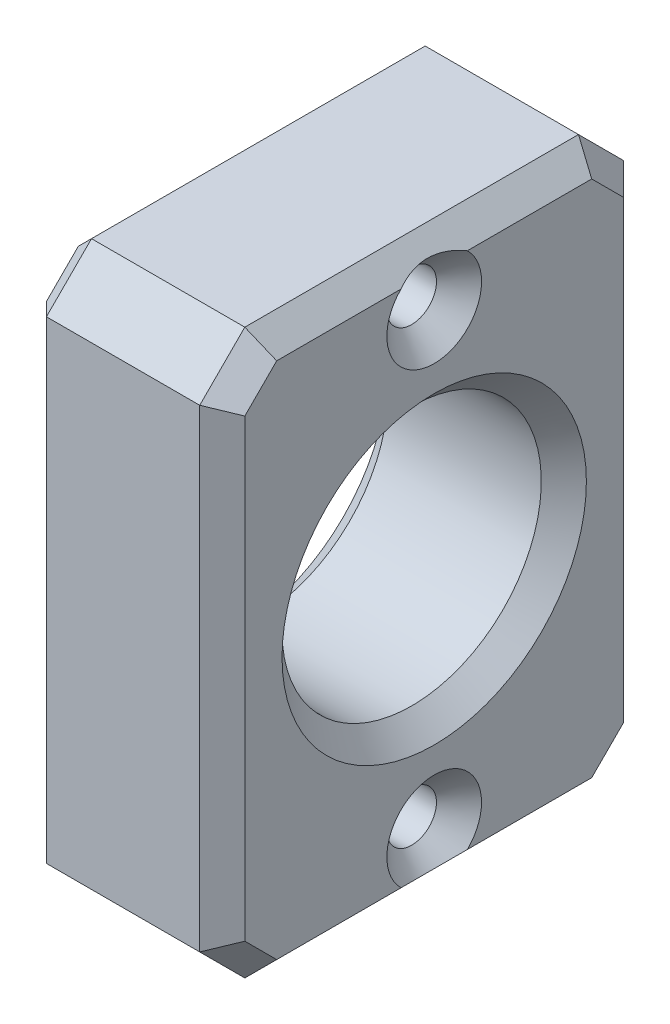
from build123d import *

# Parameters (mm, degrees)
SKETCH1_W           = 47.752
SKETCH1_H           = 63.5
SKETCH1_R           = 14.605
SKETCH1_R_2         = 2.794
BOSS_EXTRUDE1_DEPTH = 11.176
FILLET1_SIZE        = 5.08
CHAMFER1_SIZE       = 2.54


with BuildPart() as part:
    # Sketch1 → Boss-Extrude1 (new, symmetric)
    with BuildSketch(Plane(origin=(0, 0, 0), x_dir=(0, 0, -1), z_dir=(1, 0, 0))):
        Rectangle(SKETCH1_W, SKETCH1_H)
        Circle(SKETCH1_R, mode=Mode.SUBTRACT)
        with Locations((0, -25.4)):
            Circle(SKETCH1_R_2, mode=Mode.SUBTRACT)
        with Locations((0, 25.4)):
            Circle(SKETCH1_R_2, mode=Mode.SUBTRACT)
    extrude(amount=BOSS_EXTRUDE1_DEPTH, both=True)

    # Fillet1
    fillet1_edges = [part.edges().sort_by_distance(p)[0] for p in [
        (0, -31.75, -23.876),
        (0, -31.75, 23.876),
        (0, 31.75, 23.876),
        (0, 31.75, -23.876),
    ]]
    chamfer(fillet1_edges, length=FILLET1_SIZE)

    # Chamfer1
    # the kernel refuses this chamfer: 2.54 mm, written as the material it takes off along each edge
    with BuildSketch(Plane(origin=(-11.176, 0, 0), x_dir=(0, 0, -1), z_dir=(0, -1, 0))) as chamfer1_piece_1:
        Polygon((14.605 + CHAMFER1_SIZE, 0), (14.605, CHAMFER1_SIZE), (14.605, 0), align=None)
    revolve(axis=Axis((-11.176, 0, 0), (1, 0, 0)), mode=Mode.SUBTRACT)
    with BuildSketch(Plane(origin=(11.176, 0, 0), x_dir=(0, 0, -1), z_dir=(0, -1, 0))) as chamfer1_piece_2:
        Polygon((14.605 + CHAMFER1_SIZE, 0), (14.605, -CHAMFER1_SIZE), (14.605, 0), align=None)
    revolve(axis=Axis((11.176, 0, 0), (1, 0, 0)), mode=Mode.SUBTRACT)
    with BuildSketch(Plane(origin=(-11.176, -25.4, 0), x_dir=(0, 0, -1), z_dir=(0, -1, 0))) as chamfer1_piece_3:
        Polygon((2.794 + CHAMFER1_SIZE, 0), (2.794, CHAMFER1_SIZE), (2.794, 0), align=None)
    revolve(axis=Axis((-11.176, -25.4, 0), (1, 0, 0)), mode=Mode.SUBTRACT)
    with BuildSketch(Plane(origin=(11.176, -25.4, 0), x_dir=(0, 0, -1), z_dir=(0, -1, 0))) as chamfer1_piece_4:
        Polygon((2.794 + CHAMFER1_SIZE, 0), (2.794, -CHAMFER1_SIZE), (2.794, 0), align=None)
    revolve(axis=Axis((11.176, -25.4, 0), (1, 0, 0)), mode=Mode.SUBTRACT)
    with BuildSketch(Plane(origin=(-11.176, 25.4, 0), x_dir=(0, 0, -1), z_dir=(0, -1, 0))) as chamfer1_piece_5:
        Polygon((2.794 + CHAMFER1_SIZE, 0), (2.794, CHAMFER1_SIZE), (2.794, 0), align=None)
    revolve(axis=Axis((-11.176, 25.4, 0), (1, 0, 0)), mode=Mode.SUBTRACT)
    with BuildSketch(Plane(origin=(11.176, 25.4, 0), x_dir=(0, 0, -1), z_dir=(0, -1, 0))) as chamfer1_piece_6:
        Polygon((2.794 + CHAMFER1_SIZE, 0), (2.794, -CHAMFER1_SIZE), (2.794, 0), align=None)
    revolve(axis=Axis((11.176, 25.4, 0), (1, 0, 0)), mode=Mode.SUBTRACT)
    with BuildSketch(Plane(origin=(-11.176, 31.75, -25.328074789), x_dir=(-0.02749587661058663, -0.9996219169112968, 0), z_dir=(0, 0, 1)), Plane(origin=(11.176, -31.75, 25.328074789), x_dir=(-0.9996219169112968, -0.02749587661058591, 0), z_dir=(0, 0, -1))) as chamfer1_piece_7:
        Polygon((CHAMFER1_SIZE * 0.999621916911, CHAMFER1_SIZE * 0.0274958766106), (-CHAMFER1_SIZE * 0.0274958766106, CHAMFER1_SIZE * 0.999621916911), (0, 0), align=None)
    extrude(amount=50.656149579, mode=Mode.SUBTRACT)
    with BuildSketch(Plane(origin=(11.176, 31.75, -25.328074789), x_dir=(0.02749587661058663, -0.9996219169112968, 0), z_dir=(0, 0, 1)), Plane(origin=(-11.176, -31.75, 25.328074789), x_dir=(0.9996219169112968, -0.02749587661058591, 0), z_dir=(0, 0, -1))) as chamfer1_piece_8:
        Polygon((CHAMFER1_SIZE * 0.999621916911, -CHAMFER1_SIZE * 0.0274958766106), (-CHAMFER1_SIZE * 0.0274958766106, -CHAMFER1_SIZE * 0.999621916911), (0, 0), align=None)
    extrude(amount=50.656149579, mode=Mode.SUBTRACT)
    with BuildSketch(Plane(origin=(-11.176, -33.202074789, -23.876), x_dir=(-0.02749587661058663, 0, 0.9996219169112968), z_dir=(0, 1, 0)), Plane(origin=(-11.176, 33.202074789, 23.876), x_dir=(-0.02749587661058663, 0, -0.9996219169112968), z_dir=(0, -1, 0))) as chamfer1_piece_9:
        Polygon((CHAMFER1_SIZE * 0.999621916911, CHAMFER1_SIZE * 0.0274958766106), (-CHAMFER1_SIZE * 0.0274958766106, CHAMFER1_SIZE * 0.999621916911), (0, 0), align=None)
    extrude(amount=66.404149579, mode=Mode.SUBTRACT)
    with BuildSketch(Plane(origin=(-11.176, -36.368874379, -14.177125621), x_dir=(-0.027495876610586566, 0.7068394360706737, 0.7068394360706733), z_dir=(0, 0.7071067811865474, -0.7071067811865477)), Plane(origin=(11.176, -36.368874379, -14.177125621), x_dir=(-0.9996219169112966, -0.019442520806015103, -0.019442520806015093), z_dir=(0, 0.7071067811865474, -0.7071067811865477)), Plane(origin=(11.176, 22.051125621, 28.494874379), x_dir=(0.027495876610586632, -0.7068394360706737, -0.7068394360706733), z_dir=(0, 0.7071067811865474, -0.7071067811865477)), Plane(origin=(11.176, 36.368874379, -14.177125621), x_dir=(0.027495876610586566, -0.7068394360706737, 0.7068394360706733), z_dir=(0, -0.7071067811865474, -0.7071067811865477))) as chamfer1_piece_10:
        Polygon((CHAMFER1_SIZE * 0.999621916911, CHAMFER1_SIZE * 0.0274958766106), (-CHAMFER1_SIZE * 0.0274958766106, CHAMFER1_SIZE * 0.999621916911), (0, 0), align=None)
    extrude(amount=20.248354476, mode=Mode.SUBTRACT)
    with BuildSketch(Plane(origin=(-11.176, -36.368874379, 14.177125621), x_dir=(-0.027495876610586566, 0.7068394360706737, -0.7068394360706733), z_dir=(0, 0.7071067811865474, 0.7071067811865477)), Plane(origin=(-11.176, 22.051125621, 28.494874379), x_dir=(-0.027495876610586632, -0.7068394360706737, -0.7068394360706733), z_dir=(0, 0.7071067811865474, -0.7071067811865477)), Plane(origin=(-11.176, 36.368874379, -14.177125621), x_dir=(-0.027495876610586566, -0.7068394360706737, 0.7068394360706733), z_dir=(0, -0.7071067811865474, -0.7071067811865477)), Plane(origin=(11.176, -36.368874379, 14.177125621), x_dir=(-0.9996219169112966, -0.019442520806015457, 0.019442520806015447), z_dir=(0, 0.7071067811865474, 0.7071067811865477))) as chamfer1_piece_11:
        Polygon((CHAMFER1_SIZE * 0.999621916911, -CHAMFER1_SIZE * 0.0274958766106), (-CHAMFER1_SIZE * 0.0274958766106, -CHAMFER1_SIZE * 0.999621916911), (0, 0), align=None)
    extrude(amount=20.248354476, mode=Mode.SUBTRACT)
    with BuildSketch(Plane(origin=(11.176, -33.202074789, -23.876), x_dir=(0.02749587661058663, 0, 0.9996219169112968), z_dir=(0, 1, 0)), Plane(origin=(11.176, 33.202074789, 23.876), x_dir=(0.02749587661058663, 0, -0.9996219169112968), z_dir=(0, -1, 0))) as chamfer1_piece_12:
        Polygon((CHAMFER1_SIZE * 0.999621916911, -CHAMFER1_SIZE * 0.0274958766106), (-CHAMFER1_SIZE * 0.0274958766106, -CHAMFER1_SIZE * 0.999621916911), (0, 0), align=None)
    extrude(amount=66.404149579, mode=Mode.SUBTRACT)


solid = part.part
